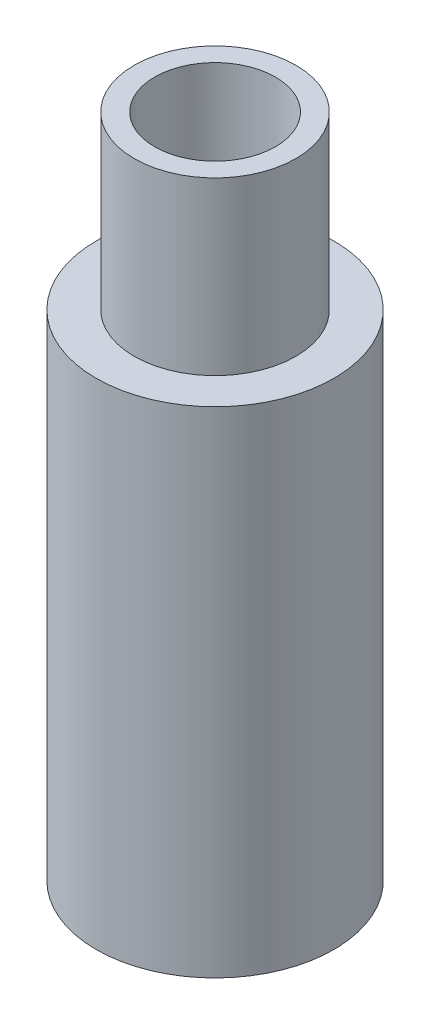
from build123d import *

# Parameters (mm, degrees)
SKETCH1_R           = 6.25
SKETCH1_R_2         = 3.175
BOSS_EXTRUDE1_DEPTH = 35
SKETCH2_OUTSIDE_W   = 22.342
SKETCH2_OUTSIDE_H   = 22.342
SKETCH2_OUTSIDE_R   = 4.25
CUT_EXTRUDE1_DEPTH  = 9
CUT_EXTRUDE2_START  = -9
SKETCH3_R           = 4.25
CUT_EXTRUDE2_DEPTH  = 9


with BuildPart() as part:
    # Sketch1 → Boss-Extrude1 (new body)
    with BuildSketch(Plane(origin=(0, 0, 0), x_dir=(1, 0, 0), z_dir=(0, 1, 0))):
        Circle(SKETCH1_R)
        Circle(SKETCH1_R_2, mode=Mode.SUBTRACT)
    extrude(amount=BOSS_EXTRUDE1_DEPTH)

    # Sketch2 outside → Cut-Extrude1 (cut)
    with BuildSketch(Plane(origin=(0, 35, 0), x_dir=(1, 0, 0), z_dir=(0, 1, 0))):
        Rectangle(SKETCH2_OUTSIDE_W, SKETCH2_OUTSIDE_H)
        Circle(SKETCH2_OUTSIDE_R, mode=Mode.SUBTRACT)
    extrude(amount=-CUT_EXTRUDE1_DEPTH, mode=Mode.SUBTRACT)

    # Sketch3 → Cut-Extrude2 (cut)
    with BuildSketch(Plane.XZ.offset(CUT_EXTRUDE2_START)):
        Circle(SKETCH3_R)
    extrude(amount=CUT_EXTRUDE2_DEPTH, mode=Mode.SUBTRACT)


solid = part.part
